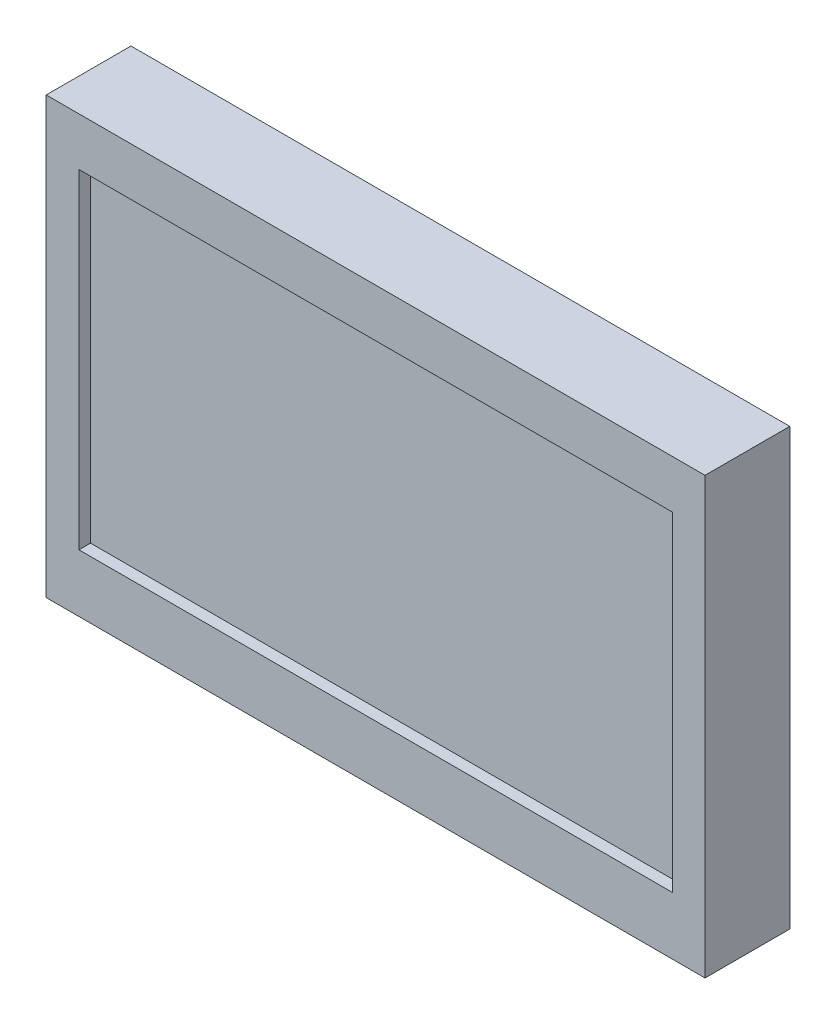
from build123d import *

# Parameters (mm, degrees)
SKETCH1_W          = 171
SKETCH1_H          = 113
EXTRUDE1_DEPTH     = 22
EXTRUDE2_START     = -3
EXTRUDE2_OUTLINE_W = 154
EXTRUDE2_OUTLINE_H = 85.5
EXTRUDE2_DEPTH     = 3
SKETCH3_R          = 2.75
EXTRUDE3_DEPTH     = 10


# Read off the part's stored shape, not the designer's step: Extrude2
with BuildPart() as part:
    # Sketch1 → Extrude1 (new body)
    with BuildSketch(Plane.XY):
        Rectangle(SKETCH1_W, SKETCH1_H)
    extrude(amount=EXTRUDE1_DEPTH)

    # Extrude2 outline → Extrude2 (cut)
    with BuildSketch(Plane.XY.offset(22).offset(EXTRUDE2_START)):
        with Locations((0, 1.25)):
            Rectangle(EXTRUDE2_OUTLINE_W, EXTRUDE2_OUTLINE_H)
    extrude(amount=EXTRUDE2_DEPTH, mode=Mode.SUBTRACT)

    # Sketch3 → Extrude3 (cut)
    with BuildSketch(Plane.XZ.offset(56.5)):
        with Locations((0, 8.5)):
            Circle(SKETCH3_R)
    extrude(amount=-EXTRUDE3_DEPTH, mode=Mode.SUBTRACT)


solid = part.part
